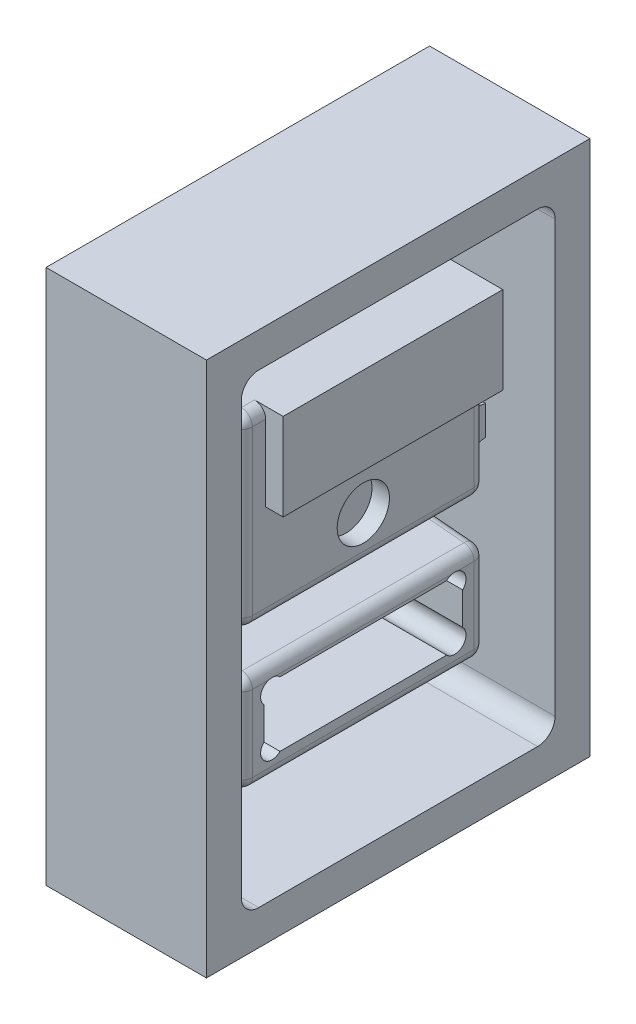
from build123d import *

# Parameters (mm, degrees)
BOSS_EXTRUDE1_DEPTH       = 30
BOSS_EXTRUDE1_DEPTH_BACK  = 30
SKETCH1_W                 = 70
SKETCH1_H                 = 30
SKETCH1_W_2               = 57
SKETCH1_H_2               = 18.5
BOSS_EXTRUDE2_DEPTH       = 35
BOSS_EXTRUDE2_DEPTH_BACK  = 35
SKETCH3_W                 = 60
SKETCH3_H                 = 30
SKETCH3_W_2               = 50
SKETCH3_H_2               = 18.5
BOSS_EXTRUDE3_DEPTH       = 35
BOSS_EXTRUDE3_DEPTH_BACK  = 35
SKETCH5_W                 = 60
SKETCH5_H                 = 25
SKETCH5_R                 = 7.95
BOSS_EXTRUDE4_DEPTH       = 7
CUT_EXTRUDE1_REACH        = 106.246
SKETCH6_W                 = 11
SKETCH6_H                 = 5
SKETCH7_W                 = 11
SKETCH7_H                 = 8.362797957
CUT_EXTRUDE2_DEPTH        = 6
FILLET2_R                 = 2
CUT_EXTRUDE3_DEPTH        = 105
CUT_EXTRUDE5_DEPTH        = 75
CUT_EXTRUDE5_DEPTH_BACK   = 75
SKETCH12_R                = 7.5
CUT_EXTRUDE6_DEPTH        = 75
CUT_EXTRUDE6_DEPTH_BACK   = 75
SKETCH13_R                = 3.25
SKETCH11_W                = 180.789243702
SKETCH11_H                = 203.682831454
CUT_EXTRUDE4_DEPTH        = 75
SKETCH14_W                = 110
SKETCH14_H                = 153.5
SKETCH14_W_2              = 90
SKETCH14_H_2              = 133.5
BOSS_EXTRUDE7_DEPTH       = 40
SKETCH15_W                = 110
SKETCH15_H                = 153.5
BOSS_EXTRUDE8_DEPTH       = 10
SKETCH16_W                = 70
SKETCH16_H                = 25
BOSS_EXTRUDE9_DEPTH       = 35
SKETCH18_W                = 7
SKETCH18_H                = 25
CUT_EXTRUDE8_DEPTH        = 5
FILLET9_R                 = 3.2
BOSS_EXTRUDE10_DEPTH      = 40
BOSS_EXTRUDE10_DEPTH_BACK = 40
SKETCH19_W                = 25
SKETCH19_H                = 18.5
CUT_EXTRUDE10_DEPTH       = 53
SKETCH26_R                = 3.25
CUT_EXTRUDE14_DEPTH       = 4
SKETCH28_R                = 5
SKETCH28_R_2              = 4
BOSS_EXTRUDE13_DEPTH      = 24
SKETCH23_W                = 160.880742473
SKETCH23_H                = 158.955075262
CUT_EXTRUDE13_DEPTH       = 132.519010033
FILLET10_R                = 5
CUT_EXTRUDE15_DEPTH       = 70
CUT_EXTRUDE15_DEPTH_BACK  = 80
SKETCH30_W                = 39.070468588
SKETCH30_H                = 169.95653836


with BuildPart() as part:
    # Sketch1 → Boss-Extrude1 (new, two sides: drawn at the far end of the back side and taken through both)
    with BuildSketch(Plane(origin=(0, 0, 0), x_dir=(0, 0, -1), z_dir=(1, 0, 0)).offset(-BOSS_EXTRUDE1_DEPTH_BACK)):
        Rectangle(SKETCH1_W, SKETCH1_H)
        Rectangle(SKETCH1_W_2, SKETCH1_H_2, mode=Mode.SUBTRACT)
    extrude(amount=BOSS_EXTRUDE1_DEPTH + BOSS_EXTRUDE1_DEPTH_BACK)



with BuildPart() as body_2:
    # Sketch3 → Boss-Extrude2 (new, two sides: drawn at the far end of the back side and taken through both)
    with BuildSketch(Plane.XY.offset(-BOSS_EXTRUDE2_DEPTH_BACK)):
        with Locations((0, 38.5)):
            Rectangle(SKETCH3_W, SKETCH3_H)
        with Locations((0, 38.5)):
            Rectangle(SKETCH3_W_2, SKETCH3_H_2, mode=Mode.SUBTRACT)
    extrude(amount=BOSS_EXTRUDE2_DEPTH + BOSS_EXTRUDE2_DEPTH_BACK)


with BuildPart() as part_1:
    add(part.part)

    add(body_2.part)  # Boss-Extrude3 merges body 2
    # Sketch4 → Boss-Extrude3 (add, two sides: drawn at the far end of the back side and taken through both)
    with BuildSketch(Plane.XY.offset(-BOSS_EXTRUDE3_DEPTH_BACK)):
        with BuildLine():
            Line((-7.5, 23.5), (7.5, 23.5))
            ThreePointArc((7.5, 23.5), (3.25, 19.25), (7.5, 15))
            Line((7.5, 15), (-7.5, 15))
            ThreePointArc((-7.5, 15), (-3.25, 19.25), (-7.5, 23.5))
        make_face()
    extrude(amount=BOSS_EXTRUDE3_DEPTH + BOSS_EXTRUDE3_DEPTH_BACK)

    # Sketch5 → Boss-Extrude4 (add)
    with BuildSketch(Plane.XY.offset(35)):
        with Locations((0, 66)):
            Rectangle(SKETCH5_W, SKETCH5_H)
        with Locations((-10.95, 63.975)):
            Circle(SKETCH5_R, mode=Mode.SUBTRACT)
        with Locations((10.95, 63.975)):
            Circle(SKETCH5_R, mode=Mode.SUBTRACT)
    extrude(amount=-BOSS_EXTRUDE4_DEPTH)

    # Cut-Extrude1: up to this face of the body (flat: up to its plane)
    cut_extrude1_end = Plane(part_1.part.faces().sort_by_distance((0, 53.5, -3.5))[0])
    # Sketch6 → Cut-Extrude1 (cut, up to the picked face)
    with BuildSketch(Plane(origin=(0, 78.5, 0), x_dir=(1, 0, 0), z_dir=(0, 1, 0)), mode=Mode.PRIVATE) as cut_extrude1_sk1:
        with Locations((0, -28)):
            Rectangle(SKETCH6_W, SKETCH6_H)
    cut_extrude1_tool1 = split(extrude(cut_extrude1_sk1.sketch, amount=-CUT_EXTRUDE1_REACH, mode=Mode.PRIVATE), bisect_by=cut_extrude1_end, keep=Keep.BOTH, mode=Mode.PRIVATE)
    add(cut_extrude1_tool1.solids().sort_by(Axis((0, 78.5, 28), (0, -1, 0)))[0], mode=Mode.SUBTRACT)

    # Sketch7 → Cut-Extrude2 (cut)
    with BuildSketch(Plane(origin=(0, 78.5, 0), x_dir=(1, 0, 0), z_dir=(0, 1, 0))):
        with Locations((0, -28.818601022)):
            Rectangle(SKETCH7_W, SKETCH7_H)
    extrude(amount=-CUT_EXTRUDE2_DEPTH, mode=Mode.SUBTRACT)

    # Fillet2
    fillet2_edges = [part_1.edges().sort_by_distance(p)[0] for p in [
        (-5.5, 55.843540774, 30.5),
        (5.5, 55.843540774, 30.5),
        (5.5, 71.131459226, 30.5),
        (-5.5, 71.131459226, 30.5),
        (-5.5, 75.5, 33),
        (5.5, 75.5, 33),
    ]]
    fillet(fillet2_edges, radius=FILLET2_R)

    # Sketch10 → Cut-Extrude3 (cut)
    with BuildSketch(Plane.XY.offset(35)):
        Polygon((30, 25.484729239), (30, 13.015270761), (7.129588093, 15.016172533), (7.129588093, 23.483827467), align=None)
    cut_extrude3 = extrude(amount=-CUT_EXTRUDE3_DEPTH, mode=Mode.SUBTRACT)

    # Mirror1: Cut-Extrude3 across plane
    add(cut_extrude3.mirror(Plane(origin=(0, 0, 0), x_dir=(0, 0, 1), z_dir=(1, 0, 0))), mode=Mode.SUBTRACT)

    # Sketch12 → Cut-Extrude5 (cut, two sides: drawn at the far end of the back side and taken through both)
    with BuildSketch(Plane(origin=(0, 0, 0), x_dir=(0, 0, -1), z_dir=(1, 0, 0)).offset(-CUT_EXTRUDE5_DEPTH_BACK)):
        with Locations(Location((0, 38, 0), (0, 0, 270))):
            Circle(SKETCH12_R)
    extrude(amount=CUT_EXTRUDE5_DEPTH + CUT_EXTRUDE5_DEPTH_BACK, mode=Mode.SUBTRACT)

    # Sketch13 → Cut-Extrude6 (cut, two sides: drawn at the far end of the back side and taken through both)
    with BuildSketch(Plane(origin=(0, 0, 0), x_dir=(0, 0, -1), z_dir=(1, 0, 0)).offset(-CUT_EXTRUDE6_DEPTH_BACK)):
        with Locations((-26.201902961, 6.951902961)):
            Circle(SKETCH13_R)
        with Locations((-26.201902961, -6.951902961)):
            Circle(SKETCH13_R)
        with Locations((26.201902961, 6.951902961)):
            Circle(SKETCH13_R)
        with Locations((26.201902961, -6.951902961)):
            Circle(SKETCH13_R)
    extrude(amount=CUT_EXTRUDE6_DEPTH + CUT_EXTRUDE6_DEPTH_BACK, mode=Mode.SUBTRACT)

    # Sketch11 → Cut-Extrude4 (cut)
    with BuildSketch(Plane(origin=(0, 0, 0), x_dir=(0, 0, -1), z_dir=(1, 0, 0))):
        Rectangle(SKETCH11_W, SKETCH11_H)
    extrude(amount=CUT_EXTRUDE4_DEPTH, mode=Mode.SUBTRACT)



with BuildPart() as body_2_2:
    # Sketch14 → Boss-Extrude7 (new body)
    with BuildSketch(Plane(origin=(0, 0, 0), x_dir=(0, 0, -1), z_dir=(1, 0, 0))):
        with Locations((0, 31.75)):
            Rectangle(SKETCH14_W, SKETCH14_H)
        with Locations((0, 31.75)):
            Rectangle(SKETCH14_W_2, SKETCH14_H_2, mode=Mode.SUBTRACT)
    extrude(amount=-BOSS_EXTRUDE7_DEPTH)


with BuildPart() as part_2:
    add(part_1.part)

    add(body_2_2.part)  # Boss-Extrude8 merges body 2 2
    # Sketch15 → Boss-Extrude8 (add)
    with BuildSketch(Plane(origin=(0, 0, 0), x_dir=(0, 0, -1), z_dir=(1, 0, 0))):
        with Locations((0, 31.75)):
            Rectangle(SKETCH15_W, SKETCH15_H)
    extrude(amount=BOSS_EXTRUDE8_DEPTH)

    # Sketch16 → Boss-Extrude9 (add)
    with BuildSketch(Plane.ZY):
        with Locations((0, 66)):
            Rectangle(SKETCH16_W, SKETCH16_H)
    extrude(amount=BOSS_EXTRUDE9_DEPTH)

    # Sketch18 → Cut-Extrude8 (cut)
    with BuildSketch(Plane.ZY.offset(30)):
        with Locations((31.5, 66)):
            Rectangle(SKETCH18_W, SKETCH18_H)
    extrude(amount=CUT_EXTRUDE8_DEPTH, mode=Mode.SUBTRACT)

    # Fillet9
    # the kernel refuses this fillet: 3.2 mm, written as the material it takes off along each edge
    with BuildSketch(Plane(origin=(-26.8, -11.8, 31.8), x_dir=(0, 0, 1), z_dir=(-1, 0, 0))) as fillet9_piece_1_section:
        Polygon((0, 0), (FILLET9_R, 0), (FILLET9_R, -FILLET9_R), (0, -FILLET9_R), align=None)
    fillet9_piece_1 = extrude(amount=FILLET9_R, mode=Mode.PRIVATE)
    fillet9_piece_1 = fillet9_piece_1 - Plane(origin=(-26.8, -11.8, 31.8), x_dir=(0, 0.7071067811865475, -0.7071067811865475), z_dir=(-1, 0, 0)) * Sphere(FILLET9_R, mode=Mode.PRIVATE)
    add(fillet9_piece_1, mode=Mode.SUBTRACT)
    with BuildSketch(Plane(origin=(-26.8, 10.083011004, 31.8), x_dir=(-0.08715574274765824, 0.9961946980917455, 0), z_dir=(0, 0, 1))) as fillet9_piece_2_section:
        Polygon((0, 0), (FILLET9_R, 0), (FILLET9_R, FILLET9_R * 0.916331174017), (FILLET9_R * 0.0871557427477, FILLET9_R * 0.996194698092), align=None)
    fillet9_piece_2 = extrude(amount=FILLET9_R, mode=Mode.PRIVATE)
    fillet9_piece_2 = fillet9_piece_2 - Plane(origin=(-26.8, 10.083011004, 31.8), x_dir=(0.737277336810124, -0.6755902076156602, 0), z_dir=(0, 0, 1)) * Sphere(FILLET9_R, mode=Mode.PRIVATE)
    add(fillet9_piece_2, mode=Mode.SUBTRACT)
    with BuildSketch(Plane(origin=(-26.8, 10.083011004, -31.8), x_dir=(-0.08715574274765824, 0.9961946980917455, 0), z_dir=(0, 0, -1))) as fillet9_piece_3_section:
        Polygon((0, 0), (FILLET9_R, 0), (FILLET9_R, -FILLET9_R * 0.916331174017), (FILLET9_R * 0.0871557427477, -FILLET9_R * 0.996194698092), align=None)
    fillet9_piece_3 = extrude(amount=FILLET9_R, mode=Mode.PRIVATE)
    fillet9_piece_3 = fillet9_piece_3 - Plane(origin=(-26.8, 10.083011004, -31.8), x_dir=(0.737277336810124, -0.6755902076156602, 0), z_dir=(0, 0, -1)) * Sphere(FILLET9_R, mode=Mode.PRIVATE)
    add(fillet9_piece_3, mode=Mode.SUBTRACT)
    with BuildSketch(Plane(origin=(-26.8, -11.8, -31.8), x_dir=(0, 0, -1), z_dir=(-1, 0, 0))) as fillet9_piece_4_section:
        Polygon((0, 0), (FILLET9_R, 0), (FILLET9_R, FILLET9_R), (0, FILLET9_R), align=None)
    fillet9_piece_4 = extrude(amount=FILLET9_R, mode=Mode.PRIVATE)
    fillet9_piece_4 = fillet9_piece_4 - Plane(origin=(-26.8, -11.8, -31.8), x_dir=(0, 0.7071067811865475, 0.7071067811865475), z_dir=(-1, 0, 0)) * Sphere(FILLET9_R, mode=Mode.PRIVATE)
    add(fillet9_piece_4, mode=Mode.SUBTRACT)
    with BuildSketch(Plane(origin=(-26.8, 75.3, 31.8), x_dir=(0, 0, 1), z_dir=(-1, 0, 0))) as fillet9_piece_5_section:
        Polygon((0, 0), (FILLET9_R, 0), (FILLET9_R, FILLET9_R), (0, FILLET9_R), align=None)
    fillet9_piece_5 = extrude(amount=FILLET9_R, mode=Mode.PRIVATE)
    fillet9_piece_5 = fillet9_piece_5 - Plane(origin=(-26.8, 75.3, 31.8), x_dir=(0, -0.7071067811865475, -0.7071067811865475), z_dir=(-1, 0, 0)) * Sphere(FILLET9_R, mode=Mode.PRIVATE)
    add(fillet9_piece_5, mode=Mode.SUBTRACT)
    with BuildSketch(Plane(origin=(-26.8, 28.416988996, 31.8), x_dir=(-0.08715574274765808, -0.9961946980917455, 0), z_dir=(0, 0, 1))) as fillet9_piece_6_section:
        Polygon((0, 0), (FILLET9_R, 0), (FILLET9_R, -FILLET9_R * 0.916331174017), (FILLET9_R * 0.0871557427477, -FILLET9_R * 0.996194698092), align=None)
    fillet9_piece_6 = extrude(amount=FILLET9_R, mode=Mode.PRIVATE)
    fillet9_piece_6 = fillet9_piece_6 - Plane(origin=(-26.8, 28.416988996, 31.8), x_dir=(0.737277336810124, 0.6755902076156605, 0), z_dir=(0, 0, 1)) * Sphere(FILLET9_R, mode=Mode.PRIVATE)
    add(fillet9_piece_6, mode=Mode.SUBTRACT)
    with BuildSketch(Plane(origin=(-26.8, 28.416988996, -31.8), x_dir=(-1, 0, 0), z_dir=(0, 0, -1))) as fillet9_piece_7_section:
        Polygon((0, 0), (FILLET9_R, 0), (FILLET9_R, -FILLET9_R * 0.916331174017), (FILLET9_R * 0.0871557427477, -FILLET9_R * 0.996194698092), align=None)
    fillet9_piece_7 = extrude(amount=FILLET9_R, mode=Mode.PRIVATE)
    fillet9_piece_7 = fillet9_piece_7 - Plane(origin=(-26.8, 28.416988996, -31.8), x_dir=(0.737277336810124, 0.6755902076156605, 0), z_dir=(0, 0, -1)) * Sphere(FILLET9_R, mode=Mode.PRIVATE)
    add(fillet9_piece_7, mode=Mode.SUBTRACT)
    with BuildSketch(Plane(origin=(-30, -11.8, 35), x_dir=(0, 0, -1), z_dir=(0, 1, 0)), Plane(origin=(-30, 10.083011004, -35), x_dir=(0, 0, 1), z_dir=(0, -1, 0))) as fillet9_piece_8:
        with BuildLine():
            CenterArc((FILLET9_R, -FILLET9_R), FILLET9_R, 90, 90)
            Line((0, -FILLET9_R), (0, 0))
            Line((0, 0), (FILLET9_R, 0))
        make_face()
    extrude(amount=21.883011004, mode=Mode.SUBTRACT)
    with BuildSketch(Plane(origin=(-30, 13.015270761, 31.8), x_dir=(0.9961946980917455, 0.0871557427476583, 0), z_dir=(0, 0, -1)), Plane(origin=(-30, 25.484729239, 31.8), x_dir=(0, 1, 0), z_dir=(0, 0, -1))) as fillet9_piece_9:
        with BuildLine():
            CenterArc((FILLET9_R * 0.916331174017, FILLET9_R), FILLET9_R, 185, 85)
            Line((-FILLET9_R * 0.0798635240743, FILLET9_R * 0.912844257252), (0, 0))
            Line((0, 0), (FILLET9_R * 0.916331174017, 0))
        make_face()
    extrude(amount=63.6, mode=Mode.SUBTRACT)
    with BuildSketch(Plane(origin=(-30, 75.3, 35), x_dir=(0, 0, -1), z_dir=(0, -1, 0))) as fillet9_piece_10:
        with BuildLine():
            CenterArc((FILLET9_R, FILLET9_R), FILLET9_R, 180, 90)
            Line((0, FILLET9_R), (0, 0))
            Line((0, 0), (FILLET9_R, 0))
        make_face()
    extrude(amount=46.883011004, mode=Mode.SUBTRACT)
    with BuildSketch(Plane(origin=(-30, 28.416988996, -35), x_dir=(0, 0, 1), z_dir=(0, 1, 0))) as fillet9_piece_11:
        with BuildLine():
            CenterArc((FILLET9_R, FILLET9_R), FILLET9_R, 180, 90)
            Line((0, FILLET9_R), (0, 0))
            Line((0, 0), (FILLET9_R, 0))
        make_face()
    extrude(amount=25.083011004, mode=Mode.SUBTRACT)
    with BuildSketch(Plane(origin=(-30, -15, -31.8), x_dir=(0, 1, 0), z_dir=(0, 0, 1))) as fillet9_piece_12:
        with BuildLine():
            CenterArc((FILLET9_R, -FILLET9_R), FILLET9_R, 90, 90)
            Line((0, -FILLET9_R), (0, 0))
            Line((0, 0), (FILLET9_R, 0))
        make_face()
    extrude(amount=63.6, mode=Mode.SUBTRACT)
    with BuildSketch(Plane(origin=(-30, 78.5, 31.8), x_dir=(1, 0, 0), z_dir=(0, 0, -1))) as fillet9_piece_13:
        with BuildLine():
            CenterArc((FILLET9_R, FILLET9_R), FILLET9_R, 180, 90)
            Line((0, FILLET9_R), (0, 0))
            Line((0, 0), (FILLET9_R, 0))
        make_face()
    extrude(amount=3.8, mode=Mode.SUBTRACT)
    with BuildSketch(Plane(origin=(0, 78.5, 35), x_dir=(0, 0, -1), z_dir=(-1, 0, 0))) as fillet9_piece_14:
        with BuildLine():
            CenterArc((FILLET9_R, FILLET9_R), FILLET9_R, 180, 90)
            Line((0, FILLET9_R), (0, 0))
            Line((0, 0), (FILLET9_R, 0))
        make_face()
    extrude(amount=26.8, mode=Mode.SUBTRACT)
    with BuildSketch(Plane(origin=(-7.129588093, 15.016172533, -35), x_dir=(0, 0, 1), z_dir=(-0.9961946980917455, -0.08715574274765824, 0)), Plane(origin=(-27.078898377, 13.270834038, 35), x_dir=(0, 0, -1), z_dir=(0.9961946980917455, 0.08715574274765824, 0)), Plane(origin=(-27.078898377, 25.229165962, -35), x_dir=(0, 0, 1), z_dir=(0.9961946980917455, -0.08715574274765808, 0)), Plane(origin=(-7.129588093, 23.483827467, 35), x_dir=(0, 0, -1), z_dir=(-0.9961946980917455, 0.08715574274765808, 0))) as fillet9_piece_15:
        with BuildLine():
            CenterArc((FILLET9_R, -FILLET9_R), FILLET9_R, 90, 90)
            Line((0, -FILLET9_R), (0, 0))
            Line((0, 0), (FILLET9_R, 0))
        make_face()
    extrude(amount=20.025513408, mode=Mode.SUBTRACT)
    with BuildSketch(Plane(origin=(-7.5, 19.25, 35), x_dir=(0.08715574274765839, -0.9961946980917455, 0), z_dir=(-0.9961946980917455, -0.08715574274765839, 0))) as fillet9_piece_16:
        with BuildLine():
            CenterArc((4.25 + FILLET9_R, -FILLET9_R), FILLET9_R, 90, 90)
            Line((4.25 + FILLET9_R, 0), (4.25, 0))
            Line((4.25, 0), (4.25, -FILLET9_R))
        make_face()
    revolve(axis=Axis((-7.5, 19.25, 35), (0, 0, 1)), revolution_arc=170, mode=Mode.SUBTRACT)
    with BuildSketch(Plane(origin=(-7.5, 19.25, -35), x_dir=(0.08715574274767615, -0.9961946980917439, 0), z_dir=(-0.9961946980917439, -0.08715574274767615, 0))) as fillet9_piece_17:
        with BuildLine():
            CenterArc((4.25 + FILLET9_R, FILLET9_R), FILLET9_R, 180, 90)
            Line((4.25 + FILLET9_R, 0), (4.25, 0))
            Line((4.25, 0), (4.25, FILLET9_R))
        make_face()
    revolve(axis=Axis((-7.5, 19.25, -35), (0, 0, 1)), revolution_arc=170, mode=Mode.SUBTRACT)
    with BuildSketch(Plane(origin=(-26.8, -15, 35), x_dir=(0, 1, 0), z_dir=(1, 0, 0)), Plane(origin=(0, -15, -35), x_dir=(0, 1, 0), z_dir=(-1, 0, 0))) as fillet9_piece_18:
        with BuildLine():
            CenterArc((FILLET9_R, -FILLET9_R), FILLET9_R, 90, 90)
            Line((0, -FILLET9_R), (0, 0))
            Line((0, 0), (FILLET9_R, 0))
        make_face()
    extrude(amount=26.8, mode=Mode.SUBTRACT)

    # Sketch19 → Boss-Extrude10 (add, two sides: drawn at the far end of the back side and taken through both)
    with BuildSketch(Plane.XY.offset(-BOSS_EXTRUDE10_DEPTH_BACK)):
        with Locations((-12.5, 38.5)):
            Rectangle(SKETCH19_W, SKETCH19_H)
    extrude(amount=BOSS_EXTRUDE10_DEPTH + BOSS_EXTRUDE10_DEPTH_BACK)

    # Sketch21 → Cut-Extrude10 (cut)
    with BuildSketch(Plane.ZY):
        with BuildLine():
            Line((-40, 42.75), (-40, 47.75))
            Line((-40, 47.75), (-35, 47.75))
            ThreePointArc((-35, 47.75), (-36.464466094, 44.214466094), (-40, 42.75))
        make_face()
        with BuildLine():
            Line((-40, 34.25), (-40, 29.25))
            Line((-40, 29.25), (-35, 29.25))
            ThreePointArc((-35, 29.25), (-36.464466094, 32.785533906), (-40, 34.25))
        make_face()
        with BuildLine():
            Line((35, 47.75), (40, 47.75))
            Line((40, 47.75), (40, 42.75))
            ThreePointArc((40, 42.75), (36.464466094, 44.214466094), (35, 47.75))
        make_face()
        with BuildLine():
            Line((40, 34.25), (40, 29.25))
            Line((40, 29.25), (35, 29.25))
            ThreePointArc((35, 29.25), (36.464466094, 32.785533906), (40, 34.25))
        make_face()
    extrude(amount=CUT_EXTRUDE10_DEPTH, mode=Mode.SUBTRACT)

    # Sketch26 → Cut-Extrude14 (cut)
    with BuildSketch(Plane.ZY):
        with Locations((-25, 88.5)):
            Circle(SKETCH26_R)
        with Locations((25, 88.5)):
            Circle(SKETCH26_R)
        with Locations((-25, -25)):
            Circle(SKETCH26_R)
        with Locations((25, -25)):
            Circle(SKETCH26_R)
    extrude(amount=-CUT_EXTRUDE14_DEPTH, mode=Mode.SUBTRACT)

    # Sketch28 → Boss-Extrude13 (add)
    with BuildSketch(Plane.XY.offset(55)):
        with Locations((0, 72)):
            Circle(SKETCH28_R)
        with Locations((0, -9)):
            Circle(SKETCH28_R_2)
    extrude(amount=-BOSS_EXTRUDE13_DEPTH)

    # Mirror3: part across plane


with BuildPart() as part_3:
    add(part_2.part)
    add(part_2.part.mirror(Plane(origin=(10, 0, 0), x_dir=(0, 0, 1), z_dir=(1, 0, 0))))

    # Sketch23 → Cut-Extrude13 (cut, through all)
    with BuildSketch(Plane(origin=(10, 0, 0), x_dir=(0, 0, -1), z_dir=(1, 0, 0))):
        with Locations((10.503639335, 31.75)):
            Rectangle(SKETCH23_W, SKETCH23_H)
    extrude(amount=-CUT_EXTRUDE13_DEPTH, mode=Mode.SUBTRACT)

    # Fillet10
    fillet10_edges = [part_3.edges().sort_by_distance(p)[0] for p in [
        (40, -35, 45),
        (40, 98.5, 45),
        (40, 98.5, -45),
        (40, -35, -45),
    ]]
    fillet(fillet10_edges, radius=FILLET10_R)

    # Sketch30 → Cut-Extrude15 (cut, two sides: drawn at the far end of the back side and taken through both)
    with BuildSketch(Plane.XY.offset(-CUT_EXTRUDE15_DEPTH_BACK)):
        with Locations((-5.535234294, 28.680177468)):
            Rectangle(SKETCH30_W, SKETCH30_H)
    extrude(amount=CUT_EXTRUDE15_DEPTH + CUT_EXTRUDE15_DEPTH_BACK, mode=Mode.SUBTRACT)


solid = part_3.part
